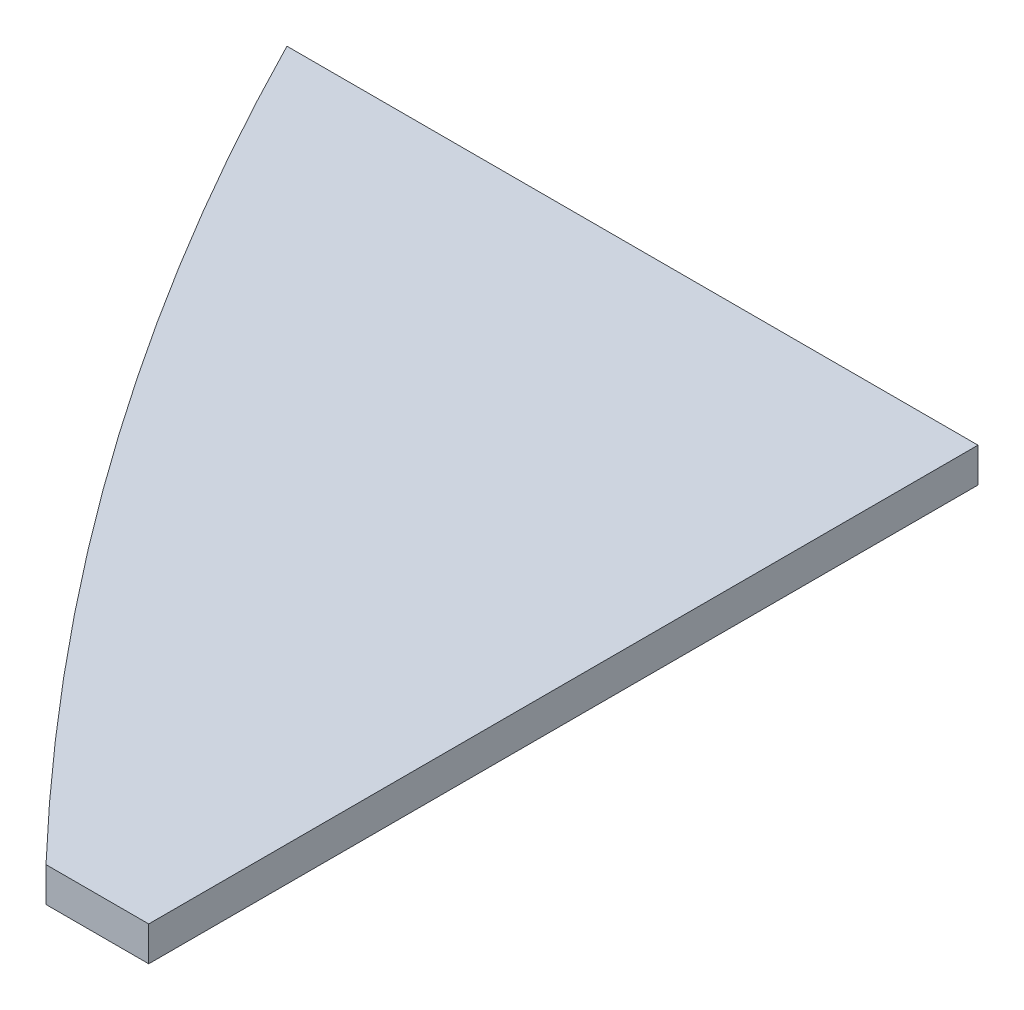
from build123d import *

# Parameters (mm, degrees)
BOSS_EXTRUDE1_DEPTH = 3.175


with BuildPart() as part:
    # Sketch1 → Boss-Extrude1 (new body)
    with BuildSketch(Plane(origin=(0, 0, 0), x_dir=(1, 0, 0), z_dir=(0, 1, 0))):
        with BuildLine():
            Line((36.786206897, 0), (-26.713793103, 0))
            add(Edge.make_bspline(
                [(-26.713793103, 0), (-5.273974996, -42.122776584), (27.346845479, -76.2)],
                knots=[0, 0, 0, 1, 1, 1], degree=2))
            Line((27.346845479, -76.2), (36.786206897, -76.2))
            Line((36.786206897, -76.2), (36.786206897, 0))
        make_face()
    extrude(amount=-BOSS_EXTRUDE1_DEPTH)


solid = part.part
